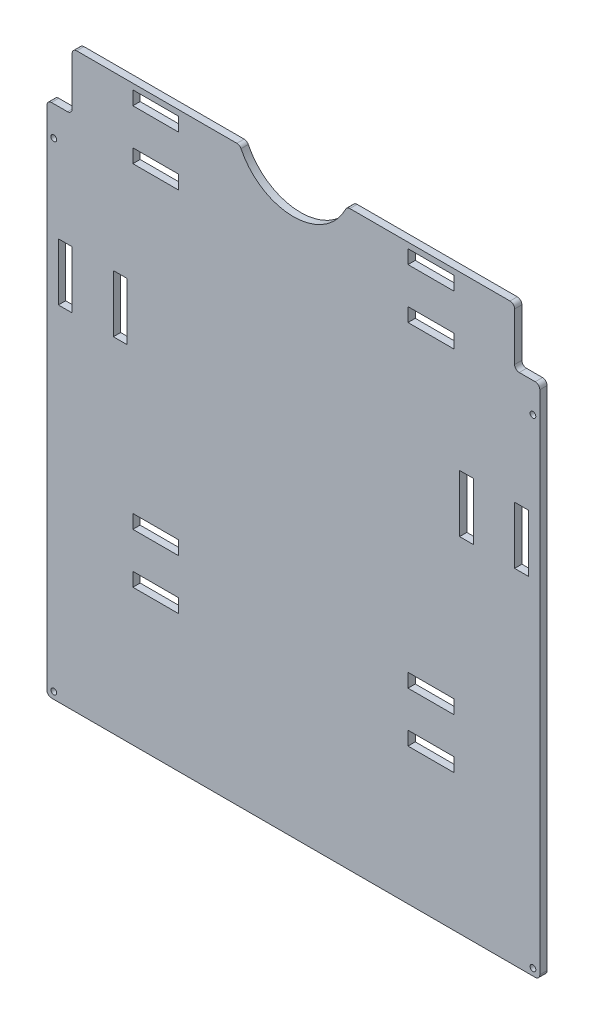
from build123d import *

# Parameters (mm, degrees)
SKETCH1_W                 = 215
SKETCH1_H                 = 250
BOSS_EXTRUDE1_DEPTH       = 3.175
SKETCH2_R                 = 25.4
CUT_EXTRUDE1_DEPTH        = 165.897940027
SKETCH3_W                 = 11
SKETCH3_H                 = 25
CUT_EXTRUDE2_DEPTH        = 165.897940027
FILLET1_R                 = 2
SKETCH4_W                 = 20
SKETCH4_H                 = 6
CUT_EXTRUDE3_DEPTH        = 165.897940027
LPATTERN1_COUNT           = 2
LPATTERN1_PITCH           = 160
LPATTERN1_COPY_1_SKETCH_W = 20
LPATTERN1_COPY_1_SKETCH_H = 6
LPATTERN1_COPY_1_DEPTH    = 165.897940027
M3X0_5_TAPPED_HOLE1_D     = 2.5
SKETCH9_W                 = 6
SKETCH9_H                 = 25
CUT_EXTRUDE4_DEPTH        = 165.897940027


with BuildPart() as part:
    # Sketch1 → Boss-Extrude1 (new body)
    with BuildSketch(Plane.XY):
        Rectangle(SKETCH1_W, SKETCH1_H)
    extrude(amount=BOSS_EXTRUDE1_DEPTH)

    # Sketch2 → Cut-Extrude1 (cut, through all)
    with BuildSketch(Plane.XY.offset(3.175)):
        with Locations((0, 135)):
            Circle(SKETCH2_R)
    extrude(amount=-CUT_EXTRUDE1_DEPTH, mode=Mode.SUBTRACT)

    # Sketch3 → Cut-Extrude2 (cut, through all)
    with BuildSketch(Plane.XY.offset(3.175)):
        with Locations((-102, 112.5)):
            Rectangle(SKETCH3_W, SKETCH3_H)
    cut_extrude2 = extrude(amount=-CUT_EXTRUDE2_DEPTH, mode=Mode.SUBTRACT)

    # Mirror1: Cut-Extrude2 across plane
    add(cut_extrude2.mirror(Plane(origin=(0, 0, 0), x_dir=(0, 0, 1), z_dir=(1, 0, 0))), mode=Mode.SUBTRACT)

    # Fillet1
    fillet1_edges = [part.edges().sort_by_distance(p)[0] for p in [
        (107.5, 100, 1.5875),
        (107.5, -125, 1.5875),
        (-107.5, -125, 1.5875),
        (-107.5, 100, 1.5875),
        (-96.5, 100, 1.5875),
        (23.348661632, 125, 1.5875),
        (96.5, 125, 1.5875),
        (96.5, 100, 1.5875),
        (-23.348661632, 125, 1.5875),
        (-96.5, 125, 1.5875),
    ]]
    fillet(fillet1_edges, radius=FILLET1_R)

    # Sketch4 → Cut-Extrude3 (cut, through all)
    with BuildSketch(Plane(origin=(0, 0, 0), x_dir=(-1, 0, 0), z_dir=(0, 0, -1))):
        with Locations((-60, -40.5)):
            Rectangle(SKETCH4_W, SKETCH4_H)
        with Locations((-60, -62.375)):
            Rectangle(SKETCH4_W, SKETCH4_H)
    cut_extrude3 = extrude(amount=-CUT_EXTRUDE3_DEPTH, mode=Mode.SUBTRACT)

    # Mirror2: Cut-Extrude3 across plane
    add(cut_extrude3.mirror(Plane(origin=(0, 0, 0), x_dir=(0, 0, 1), z_dir=(1, 0, 0))), mode=Mode.SUBTRACT)

    # LPattern1: Cut-Extrude3 ×2
    with Locations(*[(0, i * LPATTERN1_PITCH, 0) for i in range(1, LPATTERN1_COUNT)]):
        add(cut_extrude3, mode=Mode.SUBTRACT)

    # LPattern1 copy 1 sketch → LPattern1 copy 1 (cut, through all)
    with BuildSketch(Plane(origin=(0, 160, 0), x_dir=(1, 0, 0), z_dir=(0, 0, -1))):
        with Locations((-60, 40.5)):
            Rectangle(LPATTERN1_COPY_1_SKETCH_W, LPATTERN1_COPY_1_SKETCH_H)
        with Locations((-60, 62.375)):
            Rectangle(LPATTERN1_COPY_1_SKETCH_W, LPATTERN1_COPY_1_SKETCH_H)
    extrude(amount=-LPATTERN1_COPY_1_DEPTH, mode=Mode.SUBTRACT)

    # M3x0.5 Tapped Hole1 (through all)
    with Locations(Plane(origin=(0, 0, 0), x_dir=(-1, 0, 0), z_dir=(0, 0, -1))):
        with Locations((-104.5, 87), (104.5, 87), (104.5, -122), (-104.5, -122)):
            Hole(M3X0_5_TAPPED_HOLE1_D / 2)

    # Sketch9 → Cut-Extrude4 (cut, through all)
    with BuildSketch(Plane(origin=(0, 0, 0), x_dir=(-1, 0, 0), z_dir=(0, 0, -1))):
        with Locations((75.5, 37.5)):
            Rectangle(SKETCH9_W, SKETCH9_H)
        with Locations((99.5, 37.5)):
            Rectangle(SKETCH9_W, SKETCH9_H)
    cut_extrude4 = extrude(amount=-CUT_EXTRUDE4_DEPTH, mode=Mode.SUBTRACT)

    # Mirror3: Cut-Extrude4 across plane
    add(cut_extrude4.mirror(Plane(origin=(0, 0, 0), x_dir=(0, 0, 1), z_dir=(1, 0, 0))), mode=Mode.SUBTRACT)


solid = part.part
